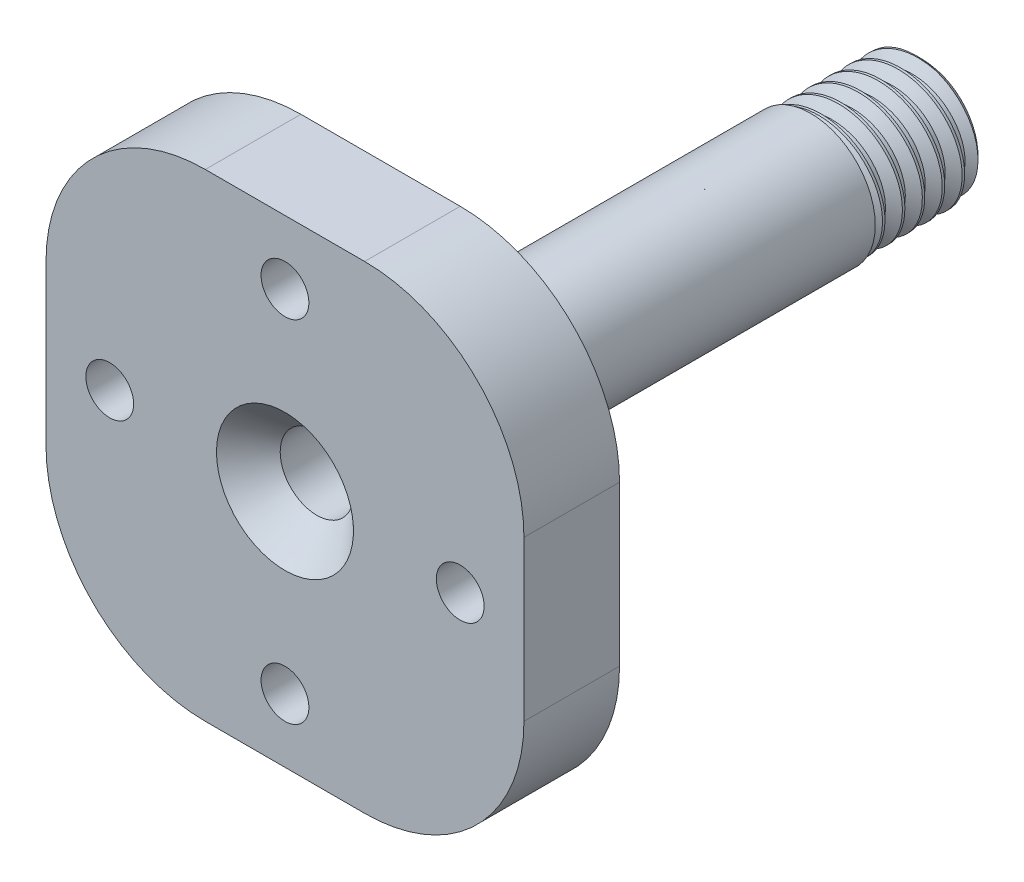
from build123d import *

# Parameters (mm, degrees)
CROQUIS1_R                 = 3.9
SALIENTE_EXTRUIR1_DEPTH    = 7
CHAFL_N2_SIZE              = 0.4
ROSCA1_PITCH               = 1.25
CROQUIS20_R                = 4.05
SALIENTE_EXTRUIR2_DEPTH    = 25
CROQUIS21_R                = 5.5
SALIENTE_EXTRUIR3_DEPTH    = 2
CROQUIS23_W                = 30
CROQUIS23_H                = 30
CROQUIS23_R                = 1.5
SALIENTE_EXTRUIR4_DEPTH    = 6
CHAFL_N3_SIZE              = 2
CROQUIS24_R                = 3.5
CORTAR_EXTRUIR2_DEPTH      = 3
CORTAR_EXTRUIR1_DEPTH      = 40.230090492
CORTAR_EXTRUIR1_DEPTH_BACK = 40.230090492
CROQUIS1_3_R               = 2.3
CHAFL_N4_SIZE              = 2
REDONDEO1_R                = 10


with BuildPart() as part:
    # Croquis1 → Saliente-Extruir1 (new body)
    with BuildSketch(Plane.XY):
        Circle(CROQUIS1_R)
    extrude(amount=-SALIENTE_EXTRUIR1_DEPTH)

    # Chaflán2
    chafl_n2_edges = [part.edges().sort_by_distance(p)[0] for p in [
        (-3.9, 0, -7),
    ]]
    chamfer(chafl_n2_edges, length=CHAFL_N2_SIZE)

    # Rosca1: the profile of Perfil de rosca1 profile screwed along a right-hand helix of 7.2 turns, 8 arcs to a turn; built about Z, then put on its axis
    rosca1_z = Axis((0, 0, 0), (0, 0, 1))
    rosca1_corners = [(3.9003, 0, -0.000173205), (3.9003, 0, 1.093923202), (3.223417656, 0, 0.703124998), (3.223417656, 0, 0.390624998)]
    with BuildLine(mode=Mode.PRIVATE) as rosca1_profile:
        Line(rosca1_corners[0], rosca1_corners[1])
        Line(rosca1_corners[1], rosca1_corners[2])
        Line(rosca1_corners[2], rosca1_corners[3])
        Line(rosca1_corners[3], rosca1_corners[0])
    rosca1_cap = Face(rosca1_profile.wire())
    rosca1_turn_angles = [0, 22.5, 45, 67.5, 90, 112.5, 135, 157.5, 180, 202.5, 225, 247.5, 270, 292.5, 315, 337.5, 360]
    rosca1_turn_weights = [1, 0.9238795325112867, 1, 0.9238795325112867, 1, 0.9238795325112867, 1, 0.9238795325112867, 1, 0.9238795325112867, 1, 0.9238795325112867, 1, 0.9238795325112867, 1, 0.9238795325112867, 1]
    rosca1_turn_rails = [Edge.make_bspline([Vector(p[0], p[1], 0).rotate(rosca1_z, rosca1_turn_angles[k]) / rosca1_turn_weights[k] + Vector(0, 0, p[2] + ROSCA1_PITCH * rosca1_turn_angles[k] / 360) for k in range(17)], [0, 0, 0, 1, 1, 2, 2, 3, 3, 4, 4, 5, 5, 6, 6, 7, 7, 8, 8, 8], 2, rosca1_turn_weights) for p in rosca1_corners]
    rosca1_turn_sides = [Face.make_surface_from_curves(rosca1_turn_rails[p[0]], rosca1_turn_rails[p[1]]) for p in [(0, 1), (1, 2), (2, 3), (3, 0)]]
    rosca1_last_angles = [2520, 2542.5, 2565, 2578.5, 2592]
    rosca1_last_weights = [1, 0.9238795325112867, 1, 0.9723699203976766, 1]
    rosca1_last_rails = [Edge.make_bspline([Vector(p[0], p[1], 0).rotate(rosca1_z, rosca1_last_angles[k]) / rosca1_last_weights[k] + Vector(0, 0, p[2] + ROSCA1_PITCH * rosca1_last_angles[k] / 360) for k in range(5)], [0, 0, 0, 1, 1, 2, 2, 2], 2, rosca1_last_weights) for p in rosca1_corners]
    rosca1_last_sides = [Face.make_surface_from_curves(rosca1_last_rails[p[0]], rosca1_last_rails[p[1]]) for p in [(0, 1), (1, 2), (2, 3), (3, 0)]]
    rosca1 = Plane(origin=(0, 0, -8.1), x_dir=(1, 0, 0), z_dir=(0, 0, 1)) * Solid(Shell([*[p.moved(Location((0, 0, ROSCA1_PITCH * i))) for i in range(7) for p in rosca1_turn_sides], *rosca1_last_sides, rosca1_cap, rosca1_cap.rotate(rosca1_z, 2592).moved(Location((0, 0, ROSCA1_PITCH * 2592 / 360)))]))
    add(rosca1, mode=Mode.SUBTRACT)

    # Croquis20 → Saliente-Extruir2 (add)
    with BuildSketch(Plane.XY):
        Circle(CROQUIS20_R)
    extrude(amount=SALIENTE_EXTRUIR2_DEPTH)

    # Croquis21 → Saliente-Extruir3 (add)
    with BuildSketch(Plane.XY.offset(25)):
        Circle(CROQUIS21_R)
    extrude(amount=SALIENTE_EXTRUIR3_DEPTH)

    # Croquis23 → Saliente-Extruir4 (add)
    with BuildSketch(Plane.XY.offset(27)):
        Rectangle(CROQUIS23_W, CROQUIS23_H)
        with Locations((-11, 0)):
            Circle(CROQUIS23_R, mode=Mode.SUBTRACT)
        with Locations((11, 0)):
            Circle(CROQUIS23_R, mode=Mode.SUBTRACT)
        with Locations((0, -11)):
            Circle(CROQUIS23_R, mode=Mode.SUBTRACT)
        with Locations((0, 11)):
            Circle(CROQUIS23_R, mode=Mode.SUBTRACT)
    extrude(amount=SALIENTE_EXTRUIR4_DEPTH)

    # Chaflán3
    chafl_n3_edges = [part.edges().sort_by_distance(p)[0] for p in [
        (-5.5, 0, 27),
    ]]
    chamfer(chafl_n3_edges, length=CHAFL_N3_SIZE - 0.0001)  # a hair under: the kernel refuses the full size

    # Croquis24 → Cortar-Extruir2 (cut)
    with BuildSketch(Plane(origin=(0, 0, 27), x_dir=(-1, 0, 0), z_dir=(0, 0, -1))):
        with Locations((11, 0)):
            Circle(CROQUIS24_R)
        with Locations((0, -11)):
            Circle(CROQUIS24_R)
        with Locations((-11, 0)):
            Circle(CROQUIS24_R)
        with Locations((0, 11)):
            Circle(CROQUIS24_R)
    extrude(amount=-CORTAR_EXTRUIR2_DEPTH, mode=Mode.SUBTRACT)

    # Croquis1<3> → Cortar-Extruir1 (cut, two sides: drawn at the far end of the back side and taken through both)
    with BuildSketch(Plane.XY.offset(-CORTAR_EXTRUIR1_DEPTH_BACK)):
        Circle(CROQUIS1_3_R)
    extrude(amount=CORTAR_EXTRUIR1_DEPTH + CORTAR_EXTRUIR1_DEPTH_BACK, mode=Mode.SUBTRACT)

    # Chaflán4
    chafl_n4_edges = [part.edges().sort_by_distance(p)[0] for p in [
        (-2.3, 0, 33),
    ]]
    chamfer(chafl_n4_edges, length=CHAFL_N4_SIZE)

    # Redondeo1
    redondeo1_edges = [part.edges().sort_by_distance(p)[0] for p in [
        (15, -15, 30),
        (15, 15, 30),
        (-15, 15, 30),
        (-15, -15, 30),
    ]]
    fillet(redondeo1_edges, radius=REDONDEO1_R)


solid = part.part
